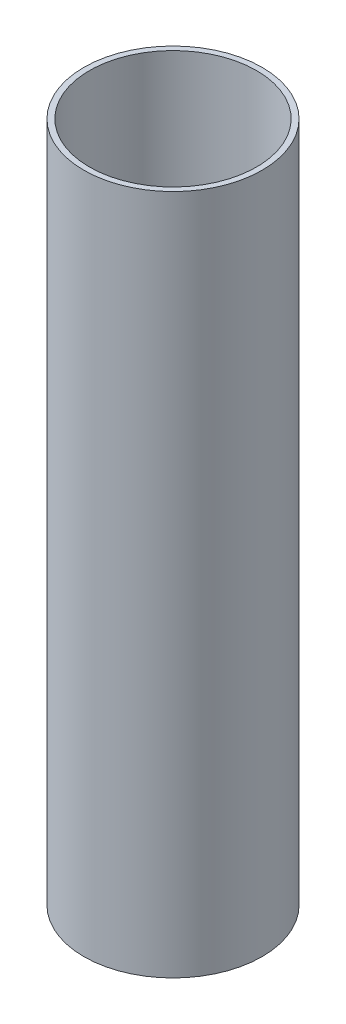
from build123d import *

# Parameters (mm, degrees)
SKETCH1_R           = 40
SKETCH1_R_2         = 37.5
BOSS_EXTRUDE1_DEPTH = 305.6


with BuildPart() as part:
    # Sketch1 → Boss-Extrude1 (new body)
    with BuildSketch(Plane(origin=(0, 0, 0), x_dir=(1, 0, 0), z_dir=(0, 1, 0))):
        Circle(SKETCH1_R)
        Circle(SKETCH1_R_2, mode=Mode.SUBTRACT)
    extrude(amount=BOSS_EXTRUDE1_DEPTH)


solid = part.part
